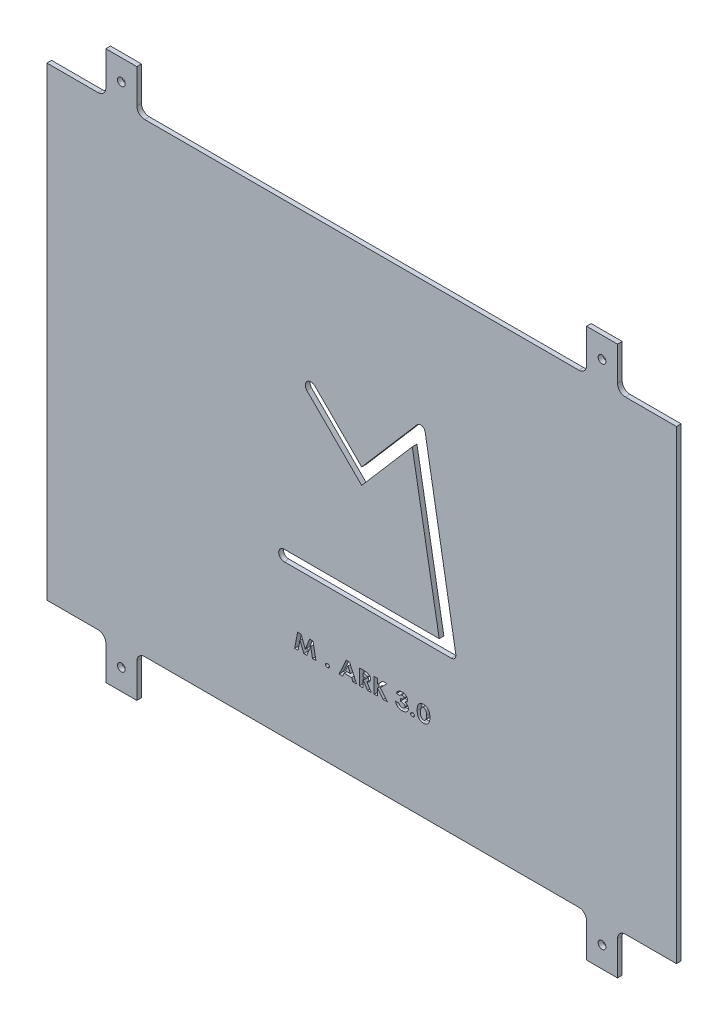
from build123d import *

# Parameters (mm, degrees)
SKETCH1_W           = 406
SKETCH1_H           = 300
BOSS_EXTRUDE1_DEPTH = 3
CUT_EXTRUDE2_DEPTH  = 253.424246062
CUT_EXTRUDE3_DEPTH  = 253.424246062
SKETCH5_W           = 20
SKETCH5_H           = 27
SKETCH5_R           = 2.5
BOSS_EXTRUDE3_DEPTH = 3
FILLET1_R           = 5


with BuildPart() as part:
    # Sketch1 → Boss-Extrude1 (new body)
    with BuildSketch(Plane.XY):
        Rectangle(SKETCH1_W, SKETCH1_H)
    extrude(amount=BOSS_EXTRUDE1_DEPTH)

    # Sketch3 → Cut-Extrude2 (cut, through all)
    with BuildSketch(Plane.XY.offset(3)):
        with BuildLine():
            Line((-50, -45), (50, -45))
            Line((50, -45), (32.635182233, 53.480775301))
            Line((32.635182233, 53.480775301), (0, 15.600108984))
            Line((0, 15.600108984), (-35.355339059, 50.955448044))
            ThreePointArc((-35.355339059, 50.955448044), (-35.164401991, 56.09613258), (-30.023717455, 55.905195512))
            Line((-30.023717455, 55.905195512), (0, 25.881478057))
            Line((0, 25.881478057), (35.717408528, 67.339779851))
            ThreePointArc((35.717408528, 67.339779851), (38.790354309, 68.2730061), (40.946387108, 65.892789812))
            Line((40.946387108, 65.892789812), (60.723152972, -48.488879105))
            ThreePointArc((60.723152972, -48.488879105), (60.061939498, -50.932179768), (57.76701437, -52))
            Line((57.76701437, -52), (-50, -52))
            ThreePointArc((-50, -52), (-53.5, -48.5), (-50, -45))
        make_face()
    extrude(amount=-CUT_EXTRUDE2_DEPTH, mode=Mode.SUBTRACT)

    # Sketch4 → Cut-Extrude3 (cut, through all)
    # profile 1 of 8: a face of its own
    with BuildSketch(Plane.XY.offset(3)):
        Polygon((-41.328125, -87), (-39.086538462, -87), (-36.346153846, -93.975160256), (-33.59775641, -87), (-31.368189103, -87), (-29.487179487, -97), (-31.696714744, -97), (-32.884615385, -90.683894231), (-35.374599359, -97), (-37.327724359, -97), (-39.807692308, -90.683894231), (-40.993589744, -97), (-43.205128205, -97), align=None)
    # profile 2 of 8: a face of its own
    with BuildSketch(Plane.XY.offset(3)):
        with BuildLine():
            add(Edge.make_bspline(
                [(-22.051282051, -94.948717949), (-21.965492792, -94.952546553), (-21.798510579, -94.959998637), (-21.557360282, -95.01879729), (-21.33803169, -95.121130381), (-21.143253871, -95.258736103), (-20.978406375, -95.422518732), (-20.857007337, -95.609884484), (-20.782654227, -95.816780635), (-20.773756298, -95.961069257), (-20.769230769, -96.034455128)],
                knots=[0, 0, 0, 0, 1.104023621, 2.148897298, 3.172284594, 4.202907706, 5.206191934, 6.146002102, 7.057047959, 8, 8, 8, 8], degree=3))
            add(Edge.make_bspline(
                [(-20.769230769, -96.034455128), (-20.773732034, -96.107855301), (-20.782582257, -96.252172042), (-20.857481369, -96.459396973), (-20.97821469, -96.64838034), (-21.14323076, -96.813934245), (-21.337375083, -96.954191289), (-21.557745391, -97.055420601), (-21.79816046, -97.117618668), (-21.965429006, -97.124614443), (-22.051282051, -97.128205128)],
                knots=[0, 0, 0, 0, 0.940548371, 1.84927189, 2.79391768, 3.800764035, 4.83372162, 5.854500209, 6.898790635, 8, 8, 8, 8], degree=3))
            add(Edge.make_bspline(
                [(-22.051282051, -97.128205128), (-22.137129782, -97.124606037), (-22.304387975, -97.117593884), (-22.544877073, -97.055512918), (-22.765470913, -96.953622083), (-22.961004493, -96.814530517), (-23.126631533, -96.648927401), (-23.244742455, -96.458776785), (-23.320100559, -96.252244256), (-23.328872091, -96.107879647), (-23.333333333, -96.034455128)],
                knots=[0, 0, 0, 0, 1.100875723, 2.144849751, 3.165319067, 4.204952963, 5.211494265, 6.151288399, 7.059736594, 8, 8, 8, 8], degree=3))
            add(Edge.make_bspline(
                [(-23.333333333, -96.034455128), (-23.328847989, -95.961044524), (-23.32002907, -95.816707273), (-23.245216503, -95.610511181), (-23.126435062, -95.421967893), (-22.96097294, -95.258143226), (-22.764819781, -95.121701974), (-22.545260995, -95.01870547), (-22.304038151, -94.960023325), (-22.137066093, -94.952554932), (-22.051282051, -94.948717949)],
                knots=[0, 0, 0, 0, 0.94266584, 1.85343518, 2.788347505, 3.79132722, 4.828678245, 5.851754927, 6.896311468, 8, 8, 8, 8], degree=3))
        make_face()
    # profile 3 of 8: a face of its own
    with BuildSketch(Plane.XY.offset(3)):
        Polygon((-10.028044872, -87), (-7.792467949, -87), (-3.269230769, -97), (-5.600961538, -97), (-6.510416667, -94.948717949), (-11.312099359, -94.948717949), (-12.219551282, -97), (-14.551282051, -97), align=None)
        Polygon((-8.91025641, -89.682291667), (-10.514823718, -93.153846154), (-7.301682692, -93.153846154), align=None, mode=Mode.SUBTRACT)
    # profile 4 of 8: a face of its own
    with BuildSketch(Plane.XY.offset(3)):
        with BuildLine():
            Line((-1.41025641, -87), (0.985576923, -87))
            add(Edge.make_bspline(
                [(0.985576923, -87), (1.143844199, -87.000492961), (1.448427932, -87.001441659), (1.887875497, -87.016324081), (2.29209751, -87.037071862), (2.660980566, -87.06857244), (2.993750693, -87.110349308), (3.291196299, -87.160211102), (3.554109452, -87.21626818), (3.785364304, -87.286038508), (3.993532596, -87.365199947), (4.187179201, -87.456554328), (4.371370087, -87.557662579), (4.544444005, -87.672822218), (4.707244652, -87.79927066), (4.859887471, -87.937942479), (5.002504161, -88.08863013), (5.13426807, -88.250743335), (5.254387386, -88.421200191), (5.357426327, -88.602020793), (5.445066858, -88.789608289), (5.518567163, -88.9847556), (5.571452591, -89.188559363), (5.61190344, -89.398550952), (5.636663189, -89.616932157), (5.639552353, -89.765026363), (5.641025641, -89.840544872)],
                knots=[0, 0, 0, 0, 1.836570219, 3.53446034, 5.10207051, 6.533260598, 7.829841073, 8.992934726, 10.032625301, 10.947036066, 11.793235874, 12.614808957, 13.429924994, 14.229421483, 15.024587688, 15.82001815, 16.620302857, 17.429949247, 18.242519826, 19.037383916, 19.841635455, 20.64338194, 21.453510251, 22.281780062, 23.123818469, 24, 24, 24, 24], degree=3))
            add(Edge.make_bspline(
                [(5.641025641, -89.840544872), (5.639700988, -89.919414321), (5.637100179, -90.074265819), (5.610290731, -90.301434081), (5.5668406, -90.518804665), (5.503475747, -90.726053816), (5.42677361, -90.924837764), (5.328814401, -91.112710707), (5.215325414, -91.290772343), (5.083101275, -91.458425368), (4.93554255, -91.617306356), (4.766856245, -91.76341326), (4.583273025, -91.902519326), (4.378797911, -92.028007271), (4.158930126, -92.146149863), (3.920886504, -92.254896347), (3.665091635, -92.352624879), (3.486569129, -92.408284344), (3.395432692, -92.436698718)],
                knots=[0, 0, 0, 0, 1.016086139, 1.994973482, 2.943504488, 3.869195015, 4.784910831, 5.685580803, 6.595129019, 7.502394393, 8.433946935, 9.385206858, 10.374891841, 11.399326033, 12.473554863, 13.590341435, 14.769859888, 16, 16, 16, 16], degree=3))
            Line((3.395432692, -92.436698718), (6.217948718, -97))
            Line((6.217948718, -97), (3.760016026, -97))
            Line((3.760016026, -97), (1.063701923, -92.641025641))
            Line((1.063701923, -92.641025641), (0.769230769, -92.641025641))
            Line((0.769230769, -92.641025641), (0.769230769, -97))
            Line((0.769230769, -97), (-1.41025641, -97))
            Line((-1.41025641, -97), (-1.41025641, -87))
        make_face()
        with BuildLine():
            Line((0.769230769, -90.846153846), (1.502403846, -90.846153846))
            add(Edge.make_bspline(
                [(1.502403846, -90.846153846), (1.591883707, -90.845192522), (1.763556746, -90.843348157), (2.010919586, -90.834735591), (2.236057963, -90.814302059), (2.439778838, -90.787993837), (2.621920902, -90.758559376), (2.781305836, -90.714965698), (2.920358792, -90.668720013), (3.038794493, -90.61206344), (3.139465541, -90.546333296), (3.226724421, -90.472412691), (3.29921512, -90.386542966), (3.360955338, -90.292586411), (3.403628226, -90.185664675), (3.438524745, -90.072094241), (3.458907272, -89.947433069), (3.460637886, -89.861318569), (3.461538462, -89.81650641)],
                knots=[0, 0, 0, 0, 1.708363675, 3.277608857, 4.723712974, 6.021838054, 7.199660436, 8.241690857, 9.172961181, 9.993967569, 10.739999558, 11.46313589, 12.168296226, 12.87908003, 13.598837728, 14.357076655, 15.145057537, 16, 16, 16, 16], degree=3))
            add(Edge.make_bspline(
                [(3.461538462, -89.81650641), (3.45969929, -89.763454538), (3.456080663, -89.659073342), (3.413413676, -89.509546122), (3.349115799, -89.369370461), (3.255365373, -89.24457729), (3.142721386, -89.131000341), (3.009655345, -89.035227064), (2.859383338, -88.956265546), (2.719795839, -88.906006995), (2.592130095, -88.874691081), (2.477160464, -88.85296137), (2.343310502, -88.835657359), (2.192425365, -88.819432909), (2.022706278, -88.807721238), (1.835005367, -88.799872694), (1.6286175, -88.796476019), (1.485043251, -88.795421228), (1.41025641, -88.794871795)],
                knots=[0, 0, 0, 0, 0.985252127, 1.938513972, 2.873098658, 3.843165384, 4.828025027, 5.842890392, 6.883115312, 7.980634618, 8.595920604, 9.330050158, 10.158404267, 11.108741491, 12.156004298, 13.326020887, 14.60714262, 16, 16, 16, 16], degree=3))
            Line((1.41025641, -88.794871795), (0.769230769, -88.794871795))
            Line((0.769230769, -88.794871795), (0.769230769, -90.846153846))
        make_face(mode=Mode.SUBTRACT)
    # profile 5 of 8: a face of its own
    with BuildSketch(Plane.XY.offset(3)):
        Polygon((8.076923077, -87), (10.256410256, -87), (10.256410256, -90.371394231), (13.417467949, -87), (16.197916667, -87), (12.049278846, -91.423076923), (16.602564103, -97), (13.956330128, -97), (10.256410256, -92.466746795), (10.256410256, -97), (8.076923077, -97), align=None)
    # profile 6 of 8: a face of its own
    with BuildSketch(Plane.XY.offset(3)):
        with BuildLine():
            Line((24.615384615, -89.435897436), (22.435897436, -89.435897436))
            add(Edge.make_bspline(
                [(22.435897436, -89.435897436), (22.451619837, -89.34605695), (22.482546857, -89.169334678), (22.556337578, -88.914502438), (22.645647584, -88.672545609), (22.756913982, -88.444754686), (22.8871191, -88.230230856), (23.036223151, -88.029365832), (23.202470589, -87.840717401), (23.328104896, -87.729255317), (23.391426282, -87.673076923)],
                knots=[0, 0, 0, 0, 1.067174566, 2.09920409, 3.101182624, 4.083726143, 5.062529949, 6.035131793, 7.009679911, 8, 8, 8, 8], degree=3))
            add(Edge.make_bspline(
                [(23.391426282, -87.673076923), (23.484145868, -87.598323866), (23.668520722, -87.449675834), (23.970491906, -87.261791178), (24.288061556, -87.099383753), (24.625298535, -86.971135455), (24.978517092, -86.866742013), (25.350349108, -86.796640554), (25.73936179, -86.750681565), (26.004804928, -86.745980805), (26.139823718, -86.743589744)],
                knots=[0, 0, 0, 0, 0.963513775, 1.91596748, 2.873425474, 3.847303723, 4.832772883, 5.851708161, 6.907262155, 8, 8, 8, 8], degree=3))
            add(Edge.make_bspline(
                [(26.139823718, -86.743589744), (26.260760658, -86.745878739), (26.49784945, -86.750366163), (26.845746053, -86.786140903), (27.177930399, -86.85001921), (27.496780557, -86.931336905), (27.798948777, -87.044581678), (28.088783259, -87.174965269), (28.361917665, -87.334430147), (28.616188185, -87.516131458), (28.849663836, -87.711554753), (29.052594902, -87.921186261), (29.227429097, -88.137712076), (29.368517708, -88.366196467), (29.47990623, -88.603197333), (29.558444093, -88.849610396), (29.605988825, -89.104870358), (29.612227329, -89.278109504), (29.615384615, -89.365785256)],
                knots=[0, 0, 0, 0, 1.203972995, 2.36030863, 3.476442814, 4.569752457, 5.631894405, 6.684988858, 7.730607218, 8.774702771, 9.793625368, 10.75742121, 11.675248853, 12.558950514, 13.424459788, 14.275965966, 15.127472144, 16, 16, 16, 16], degree=3))
            add(Edge.make_bspline(
                [(29.615384615, -89.365785256), (29.610015432, -89.474499037), (29.599384033, -89.689760763), (29.512820719, -90.004612496), (29.372974395, -90.303679556), (29.177803977, -90.585595157), (28.931598504, -90.847969797), (28.631247009, -91.081313002), (28.283617999, -91.292814884), (28.026419519, -91.403540034), (27.892628205, -91.461137821)],
                knots=[0, 0, 0, 0, 0.902812238, 1.787638331, 2.694283822, 3.636788598, 4.626642246, 5.674130132, 6.790112658, 8, 8, 8, 8], degree=3))
            add(Edge.make_bspline(
                [(27.892628205, -91.461137821), (27.978507877, -91.484535751), (28.146768607, -91.530378415), (28.387725034, -91.620118045), (28.615649818, -91.720181708), (28.829176691, -91.83313606), (29.027112987, -91.961241265), (29.211722389, -92.099161975), (29.383209047, -92.249275577), (29.537082605, -92.413892773), (29.674247002, -92.588382729), (29.798894362, -92.767542811), (29.897936354, -92.958649227), (29.984045418, -93.154539334), (30.046530937, -93.360753), (30.096799326, -93.573087003), (30.121264542, -93.794304246), (30.1258755, -93.943733517), (30.128205128, -94.019230769)],
                knots=[0, 0, 0, 0, 1.161439999, 2.275564601, 3.352689833, 4.409483066, 5.425027258, 6.427468076, 7.415594393, 8.396117101, 9.364043735, 10.311781116, 11.239872671, 12.169273241, 13.101123259, 14.048499788, 15.01402915, 16, 16, 16, 16], degree=3))
            add(Edge.make_bspline(
                [(30.128205128, -94.019230769), (30.125009633, -94.130324511), (30.118691921, -94.349964412), (30.060263065, -94.672017037), (29.968201081, -94.980747081), (29.838748645, -95.276378002), (29.670410668, -95.557723147), (29.467324816, -95.828044444), (29.224120284, -96.082429819), (28.949755785, -96.323016049), (28.646824481, -96.543187889), (28.318806587, -96.732525386), (27.972501973, -96.896870274), (27.605168338, -97.028201856), (27.217693639, -97.130553064), (26.810522781, -97.204212808), (26.382560641, -97.24920096), (26.090523021, -97.25397449), (25.94150641, -97.256410256)],
                knots=[0, 0, 0, 0, 0.904771238, 1.788794425, 2.658307691, 3.52589414, 4.411674647, 5.324918016, 6.275850375, 7.274726454, 8.295875987, 9.322666235, 10.357373388, 11.41613355, 12.497317003, 13.62033306, 14.785738966, 16, 16, 16, 16], degree=3))
            add(Edge.make_bspline(
                [(25.94150641, -97.256410256), (25.800505635, -97.253841249), (25.524529751, -97.24881302), (25.120700188, -97.2058589), (24.736794271, -97.136372801), (24.372582942, -97.038588241), (24.028715893, -96.911010495), (23.702366301, -96.760349453), (23.398560475, -96.576121812), (23.116377706, -96.365927093), (22.85815493, -96.132981407), (22.629951077, -95.877363193), (22.435010973, -95.600102423), (22.267244628, -95.305081059), (22.132586995, -94.988421262), (22.03086337, -94.651077999), (21.957864258, -94.294236557), (21.934809274, -94.04825395), (21.923076923, -93.923076923)],
                knots=[0, 0, 0, 0, 1.163132858, 2.276559241, 3.346385464, 4.379491246, 5.383511434, 6.369379209, 7.340699554, 8.309265972, 9.268764279, 10.205337855, 11.130170369, 12.060239432, 13.000694122, 13.962719923, 14.963257337, 16, 16, 16, 16], degree=3))
            Line((21.923076923, -93.923076923), (24.102564103, -93.923076923))
            add(Edge.make_bspline(
                [(24.102564103, -93.923076923), (24.116401681, -93.98605532), (24.143433086, -94.10908223), (24.197469508, -94.28621867), (24.263371754, -94.450328346), (24.340347042, -94.602533515), (24.427633313, -94.742971507), (24.528292552, -94.869502193), (24.640225063, -94.983083164), (24.802864217, -95.119366788), (25.03519483, -95.259885874), (25.347580704, -95.377551873), (25.693273716, -95.448711357), (25.934476738, -95.457155004), (26.059695513, -95.461538462)],
                knots=[0, 0, 0, 0, 0.847238011, 1.65506076, 2.430783259, 3.168647505, 3.894249557, 4.600105461, 5.288952951, 5.986742919, 7.384996884, 8.832294932, 10.355509216, 12, 12, 12, 12], degree=3))
            add(Edge.make_bspline(
                [(26.059695513, -95.461538462), (26.126521614, -95.460591038), (26.257154551, -95.458738998), (26.448735077, -95.438177604), (26.630837189, -95.404291442), (26.804141139, -95.357707688), (26.970076886, -95.300646509), (27.125920946, -95.225173736), (27.27462012, -95.139735892), (27.412329701, -95.041308132), (27.53867908, -94.934926717), (27.646248626, -94.817694718), (27.740556927, -94.696781423), (27.816424345, -94.568844611), (27.875370313, -94.434870707), (27.91729679, -94.295654679), (27.944829398, -94.150522991), (27.947410494, -94.051408423), (27.948717949, -94.001201923)],
                knots=[0, 0, 0, 0, 1.207695902, 2.360827, 3.478340193, 4.552977425, 5.602922823, 6.645067005, 7.678223387, 8.69981991, 9.701465816, 10.658091572, 11.570750188, 12.46924822, 13.339487348, 14.210145001, 15.093348681, 16, 16, 16, 16], degree=3))
            add(Edge.make_bspline(
                [(27.948717949, -94.001201923), (27.946427917, -93.946245833), (27.941853959, -93.836480181), (27.904440248, -93.676564817), (27.84553538, -93.52222991), (27.760467571, -93.376481778), (27.651892015, -93.236735898), (27.522331789, -93.101903514), (27.364487025, -92.978451204), (27.18807851, -92.857623137), (26.986545711, -92.750867431), (26.765771515, -92.653152078), (26.521385746, -92.574975399), (26.257581512, -92.506051283), (25.972108592, -92.455102468), (25.66643158, -92.418043936), (25.340354776, -92.39056616), (25.115578474, -92.386636163), (25, -92.384615385)],
                knots=[0, 0, 0, 0, 0.712260617, 1.422622151, 2.119222093, 2.848814934, 3.602540981, 4.411216623, 5.267622291, 6.197467531, 7.181999, 8.221696836, 9.325704192, 10.506537076, 11.757125606, 13.084140701, 14.500684618, 16, 16, 16, 16], degree=3))
            Line((25, -92.384615385), (25, -90.717948718))
            add(Edge.make_bspline(
                [(25, -90.717948718), (25.078134891, -90.712773296), (25.229139684, -90.702771191), (25.447674546, -90.68558419), (25.650544761, -90.662658286), (25.837833061, -90.639932572), (26.010166926, -90.611420778), (26.166467437, -90.579801565), (26.308417749, -90.546039225), (26.473065214, -90.496671773), (26.657087411, -90.422640964), (26.856470762, -90.322247621), (27.028740939, -90.204947331), (27.174602161, -90.075505521), (27.288172306, -89.933607327), (27.37327406, -89.787137617), (27.4266963, -89.635162528), (27.432865268, -89.531111202), (27.435897436, -89.479967949)],
                knots=[0, 0, 0, 0, 1.261305243, 2.437619549, 3.530325748, 4.549526295, 5.476041808, 6.342959594, 7.11771268, 7.825439131, 9.109647673, 10.307400883, 11.414149412, 12.457410992, 13.436672637, 14.327804045, 15.178083114, 16, 16, 16, 16], degree=3))
            add(Edge.make_bspline(
                [(27.435897436, -89.479967949), (27.431957966, -89.414587564), (27.424173795, -89.28539961), (27.352422756, -89.101723489), (27.232865826, -88.939844995), (27.07323423, -88.798755105), (26.879170921, -88.680380524), (26.653347393, -88.59705571), (26.400530531, -88.545877457), (26.222886522, -88.541011249), (26.129807692, -88.538461538)],
                knots=[0, 0, 0, 0, 0.873115495, 1.725226968, 2.596508184, 3.546496563, 4.56193057, 5.623390662, 6.75474542, 8, 8, 8, 8], degree=3))
            add(Edge.make_bspline(
                [(26.129807692, -88.538461538), (26.04545482, -88.54157882), (25.879467947, -88.547712906), (25.636123543, -88.595317988), (25.40437962, -88.672908941), (25.189720736, -88.783559194), (24.996187873, -88.915192325), (24.832646061, -89.069056032), (24.703567562, -89.243130746), (24.64463868, -89.37194846), (24.615384615, -89.435897436)],
                knots=[0, 0, 0, 0, 1.084879982, 2.134791974, 3.178249202, 4.21968776, 5.232697662, 6.180875624, 7.096932117, 8, 8, 8, 8], degree=3))
        make_face()
    # profile 7 of 8: a face of its own
    with BuildSketch(Plane.XY.offset(3)):
        with BuildLine():
            add(Edge.make_bspline(
                [(32.820512821, -94.948717949), (32.90630208, -94.952546553), (33.073284293, -94.959998637), (33.31443459, -95.01879729), (33.533763181, -95.121130381), (33.728541, -95.258736103), (33.893388497, -95.422518732), (34.014787535, -95.609884484), (34.089140645, -95.816780635), (34.098038574, -95.961069257), (34.102564103, -96.034455128)],
                knots=[0, 0, 0, 0, 1.104023621, 2.148897298, 3.172284594, 4.202907706, 5.206191934, 6.146002102, 7.057047959, 8, 8, 8, 8], degree=3))
            add(Edge.make_bspline(
                [(34.102564103, -96.034455128), (34.098062838, -96.107855301), (34.089212615, -96.252172042), (34.014313503, -96.459396973), (33.893580182, -96.64838034), (33.728564112, -96.813934245), (33.534419788, -96.954191289), (33.314049481, -97.055420601), (33.073634412, -97.117618668), (32.906365865, -97.124614443), (32.820512821, -97.128205128)],
                knots=[0, 0, 0, 0, 0.940548371, 1.84927189, 2.79391768, 3.800764035, 4.83372162, 5.854500209, 6.898790635, 8, 8, 8, 8], degree=3))
            add(Edge.make_bspline(
                [(32.820512821, -97.128205128), (32.73466509, -97.124606037), (32.567406897, -97.117593884), (32.326917799, -97.055512918), (32.106323959, -96.953622083), (31.910790379, -96.814530517), (31.745163339, -96.648927401), (31.627052417, -96.458776785), (31.551694313, -96.252244256), (31.542922781, -96.107879647), (31.538461538, -96.034455128)],
                knots=[0, 0, 0, 0, 1.100875723, 2.144849751, 3.165319067, 4.204952963, 5.211494265, 6.151288399, 7.059736594, 8, 8, 8, 8], degree=3))
            add(Edge.make_bspline(
                [(31.538461538, -96.034455128), (31.542946882, -95.961044524), (31.551765802, -95.816707273), (31.626578368, -95.610511181), (31.745359809, -95.421967893), (31.910821932, -95.258143226), (32.106975091, -95.121701974), (32.326533876, -95.01870547), (32.56775672, -94.960023325), (32.734728778, -94.952554932), (32.820512821, -94.948717949)],
                knots=[0, 0, 0, 0, 0.94266584, 1.85343518, 2.788347505, 3.79132722, 4.828678245, 5.851754927, 6.896311468, 8, 8, 8, 8], degree=3))
        make_face()
    # profile 8 of 8: a face of its own
    with BuildSketch(Plane.XY.offset(3)):
        with BuildLine():
            add(Edge.make_bspline(
                [(39.835737179, -86.743589744), (39.940631176, -86.74488494), (40.146750821, -86.747430038), (40.450366804, -86.77474525), (40.743288095, -86.816595855), (41.025532396, -86.873329011), (41.295429617, -86.950846392), (41.555003685, -87.042377369), (41.803188475, -87.152798677), (42.040151, -87.279337808), (42.266448166, -87.421538009), (42.478041154, -87.584189771), (42.67755099, -87.763705552), (42.864648534, -87.959402331), (43.034727295, -88.176587808), (43.195130022, -88.408013437), (43.342377665, -88.658110348), (43.474670095, -88.928022132), (43.59399893, -89.220026438), (43.69503453, -89.538581817), (43.783887869, -89.882669813), (43.851947969, -90.255167484), (43.909346327, -90.653914222), (43.944859359, -91.080698885), (43.970316511, -91.533612303), (43.972987163, -91.844377957), (43.974358974, -92.00400641)],
                knots=[0, 0, 0, 0, 0.986878607, 1.939244146, 2.866122373, 3.770685769, 4.645919486, 5.506526465, 6.358927341, 7.19947967, 8.032766199, 8.871060618, 9.707586805, 10.556552813, 11.415253582, 12.300713806, 13.20490608, 14.143531746, 15.127224312, 16.170507414, 17.286127382, 18.469254189, 19.732050249, 21.075816642, 22.49795864, 24, 24, 24, 24], degree=3))
            add(Edge.make_bspline(
                [(43.974358974, -92.00400641), (43.972910558, -92.16562941), (43.970095815, -92.479715252), (43.945814992, -92.93681344), (43.90625356, -93.366586773), (43.851075298, -93.768514844), (43.779103263, -94.143079105), (43.69124908, -94.490365307), (43.588615702, -94.810975096), (43.46684073, -95.104204448), (43.331923569, -95.373004417), (43.187024673, -95.623408669), (43.031519935, -95.855283571), (42.864659889, -96.069375472), (42.685754098, -96.263495423), (42.497826637, -96.441617232), (42.295509196, -96.597179358), (42.084825644, -96.739771822), (41.859103045, -96.860774261), (41.621686966, -96.969112901), (41.368487168, -97.054782793), (41.10308475, -97.13125619), (40.821868935, -97.184979531), (40.5273102, -97.228332493), (40.218065756, -97.251835282), (40.007380311, -97.2548642), (39.899839744, -97.256410256)],
                knots=[0, 0, 0, 0, 1.529996052, 2.973277928, 4.3319599, 5.614837321, 6.812444681, 7.940869391, 9.004374387, 9.996356283, 10.943411785, 11.849826989, 12.733472155, 13.584521289, 14.416696755, 15.230665801, 16.032367232, 16.830096171, 17.636295923, 18.454011992, 19.297680756, 20.164270776, 21.066798043, 22.005483142, 22.981935022, 24, 24, 24, 24], degree=3))
            add(Edge.make_bspline(
                [(39.899839744, -97.256410256), (39.792298675, -97.254853067), (39.580946502, -97.251792696), (39.270386782, -97.228286538), (38.973768088, -97.185125669), (38.689499992, -97.130475757), (38.418734399, -97.055529782), (38.160058762, -96.966028363), (37.91493409, -96.859604854), (37.682736227, -96.737072), (37.464322609, -96.596058382), (37.256720827, -96.43948967), (37.062423015, -96.26520178), (36.881757662, -96.072991282), (36.710587892, -95.866449523), (36.551768483, -95.641862391), (36.408901235, -95.397810879), (36.272109769, -95.138078996), (36.151336492, -94.854564293), (36.050281643, -94.543021704), (35.961483271, -94.204894407), (35.893497482, -93.837004069), (35.836896692, -93.442132365), (35.797867166, -93.018935747), (35.773460469, -92.567865211), (35.770668157, -92.257779019), (35.769230769, -92.098157051)],
                knots=[0, 0, 0, 0, 1.023105099, 2.010724743, 2.960346284, 3.873571896, 4.762817917, 5.630750533, 6.475759109, 7.302737153, 8.125679285, 8.946460815, 9.774219303, 10.605553544, 11.453922483, 12.324617337, 13.219089803, 14.142532874, 15.115994133, 16.146566678, 17.255968662, 18.439589787, 19.703655302, 21.050089352, 22.481484969, 24, 24, 24, 24], degree=3))
            add(Edge.make_bspline(
                [(35.769230769, -92.098157051), (35.772279233, -91.876390498), (35.778162841, -91.448375744), (35.823817931, -90.829541936), (35.901165616, -90.258142128), (36.007305255, -89.733191242), (36.147543188, -89.255941245), (36.316708464, -88.825009087), (36.517319107, -88.439244967), (36.682545093, -88.213462802), (36.762820513, -88.103766026)],
                knots=[0, 0, 0, 0, 1.270554087, 2.452199792, 3.552731428, 4.572428878, 5.517880761, 6.398834259, 7.222069991, 8, 8, 8, 8], degree=3))
            add(Edge.make_bspline(
                [(36.762820513, -88.103766026), (36.857155885, -87.995172643), (37.043456081, -87.780714712), (37.363859988, -87.503877854), (37.707968238, -87.266136631), (38.082782459, -87.075926715), (38.482727496, -86.924458837), (38.910416254, -86.81895418), (39.364465236, -86.756434786), (39.67594666, -86.747945012), (39.835737179, -86.743589744)],
                knots=[0, 0, 0, 0, 0.990681992, 1.956469204, 2.910354335, 3.867787993, 4.846848932, 5.852890592, 6.898529083, 8, 8, 8, 8], degree=3))
        make_face()
        with BuildLine():
            add(Edge.make_bspline(
                [(39.887820513, -88.538461538), (39.794701119, -88.54234069), (39.61127623, -88.549981771), (39.344871042, -88.609535849), (39.094139273, -88.707117235), (38.899930857, -88.82029291), (38.755266327, -88.932227867), (38.652650792, -89.030495297), (38.558693761, -89.144760604), (38.46798076, -89.270238272), (38.38645171, -89.410893082), (38.3121863, -89.56543191), (38.241888986, -89.732776711), (38.179839733, -89.916208719), (38.12548738, -90.117647508), (38.077745975, -90.338909925), (38.038592305, -90.582446225), (38.00416712, -90.846904569), (37.97871928, -91.13360472), (37.960876912, -91.442243058), (37.951401587, -91.772910693), (37.949631413, -92.000662311), (37.948717949, -92.118189103)],
                knots=[0, 0, 0, 0, 1.214825918, 2.392942023, 3.54391286, 4.716047411, 5.312397353, 5.928921511, 6.566233531, 7.241129173, 7.948299778, 8.685150259, 9.478417732, 10.316450957, 11.210975869, 12.20094717, 13.270042938, 14.430220111, 15.681923771, 17.026666981, 18.465669347, 20, 20, 20, 20], degree=3))
            add(Edge.make_bspline(
                [(37.948717949, -92.118189103), (37.949916629, -92.270476768), (37.952216053, -92.562609728), (37.978918093, -92.982365715), (38.019816906, -93.364910726), (38.076843749, -93.711864047), (38.152098799, -94.022091737), (38.243239478, -94.297141462), (38.352237726, -94.535258041), (38.480960547, -94.737268127), (38.622531652, -94.90855723), (38.773730621, -95.056327549), (38.934943317, -95.181461785), (39.105842304, -95.285040181), (39.28760848, -95.362930248), (39.478384063, -95.419847817), (39.679570863, -95.454475498), (39.817572021, -95.459155924), (39.887820513, -95.461538462)],
                knots=[0, 0, 0, 0, 1.67935368, 3.22149899, 4.63658588, 5.921150014, 7.096443814, 8.153749495, 9.112515304, 9.976701786, 10.787628061, 11.558401725, 12.303777516, 13.033787632, 13.756142503, 14.478459833, 15.22547098, 16, 16, 16, 16], degree=3))
            add(Edge.make_bspline(
                [(39.887820513, -95.461538462), (39.95539924, -95.459881617), (40.087358491, -95.456646338), (40.279789904, -95.423478868), (40.461642592, -95.369505407), (40.632381245, -95.292834587), (40.792860659, -95.195657087), (40.941710779, -95.075989806), (41.080807968, -94.93587718), (41.16107834, -94.828882316), (41.201923077, -94.774439103)],
                knots=[0, 0, 0, 0, 1.048278946, 2.046947455, 3.02099404, 3.986174388, 4.94442698, 5.925508864, 6.944416953, 8, 8, 8, 8], degree=3))
            add(Edge.make_bspline(
                [(41.201923077, -94.774439103), (41.249661683, -94.700620546), (41.349184117, -94.546728277), (41.471056183, -94.285943445), (41.568435925, -93.989168372), (41.653923754, -93.65963057), (41.714876637, -93.294098283), (41.764587112, -92.895293295), (41.788282436, -92.46101952), (41.792618665, -92.160274988), (41.794871795, -92.00400641)],
                knots=[0, 0, 0, 0, 0.73363436, 1.529434623, 2.395365967, 3.339496309, 4.370063941, 5.48791158, 6.694704504, 8, 8, 8, 8], degree=3))
            add(Edge.make_bspline(
                [(41.794871795, -92.00400641), (41.793717761, -91.846372547), (41.791495973, -91.542890016), (41.764046921, -91.107275236), (41.726238648, -90.709152376), (41.668975773, -90.349595762), (41.593447147, -90.028120774), (41.5023221, -89.744057632), (41.395063648, -89.497445687), (41.27008359, -89.287409029), (41.128219677, -89.11256316), (40.982803483, -88.957149676), (40.822943157, -88.829504753), (40.656133979, -88.721202347), (40.478090727, -88.638471237), (40.290161229, -88.580107135), (40.092080428, -88.545568503), (39.956733385, -88.540859274), (39.887820513, -88.538461538)],
                knots=[0, 0, 0, 0, 1.705083879, 3.282690406, 4.720299792, 6.030237024, 7.218210755, 8.289614354, 9.253402044, 10.121863153, 10.924008211, 11.685264082, 12.4197249, 13.131122611, 13.832435875, 14.536163306, 15.254677544, 16, 16, 16, 16], degree=3))
        make_face(mode=Mode.SUBTRACT)
    extrude(amount=-CUT_EXTRUDE3_DEPTH, mode=Mode.SUBTRACT)


with BuildPart() as cut_extrude3_piece_1:
    # of the separate pieces the step leaves, piece 1, a body of its own (cut_extrude3_pieces)
    add(part.part.solids().sort_by_distance((-203, -150, 0))[0])

    # Sketch5 → Boss-Extrude3 (add)
    # profile 1 of 4: a face of its own
    with BuildSketch(Plane.XY.offset(3)):
        with Locations((-155, 163.5)):
            Rectangle(SKETCH5_W, SKETCH5_H)
        with Locations((-155, 163.5)):
            Circle(SKETCH5_R, mode=Mode.SUBTRACT)
    # profile 2 of 4: a face of its own
    with BuildSketch(Plane.XY.offset(3)):
        with Locations((155, 163.5)):
            Rectangle(SKETCH5_W, SKETCH5_H)
        with Locations((155, 163.5)):
            Circle(SKETCH5_R, mode=Mode.SUBTRACT)
    # profile 3 of 4: a face of its own
    with BuildSketch(Plane.XY.offset(3)):
        with Locations((155, -163.5)):
            Rectangle(SKETCH5_W, SKETCH5_H)
        with Locations((155, -163.5)):
            Circle(SKETCH5_R, mode=Mode.SUBTRACT)
    # profile 4 of 4: a face of its own
    with BuildSketch(Plane.XY.offset(3)):
        with Locations((-155, -163.5)):
            Rectangle(SKETCH5_W, SKETCH5_H)
        with Locations((-155, -163.5)):
            Circle(SKETCH5_R, mode=Mode.SUBTRACT)
    extrude(amount=-BOSS_EXTRUDE3_DEPTH)

    # Fillet1
    fillet1_edges = [cut_extrude3_piece_1.edges().sort_by_distance(p)[0] for p in [
        (-165, -150, 1.5),
        (-145, -150, 1.5),
        (145, -150, 1.5),
        (165, -150, 1.5),
        (-145, 150, 1.5),
        (-165, 150, 1.5),
        (145, 150, 1.5),
        (165, 150, 1.5),
    ]]
    fillet(fillet1_edges, radius=FILLET1_R)


with BuildPart() as cut_extrude3_piece_2:
    # of the separate pieces the step leaves, piece 2, a body of its own (cut_extrude3_pieces)
    add(part.part.solids().sort_by_distance((37.948717949, -92.118189103, 0))[0])


with BuildPart() as cut_extrude3_piece_3:
    # of the separate pieces the step leaves, piece 3, a body of its own (cut_extrude3_pieces)
    add(part.part.solids().sort_by_distance((-7.301682692, -93.153846154, 0))[0])


with BuildPart() as cut_extrude3_piece_4:
    # of the separate pieces the step leaves, piece 4, a body of its own (cut_extrude3_pieces)
    add(part.part.solids().sort_by_distance((0.769230769, -88.794871795, 0))[0])


solid = Compound([cut_extrude3_piece_1.part, cut_extrude3_piece_2.part, cut_extrude3_piece_3.part, cut_extrude3_piece_4.part])
